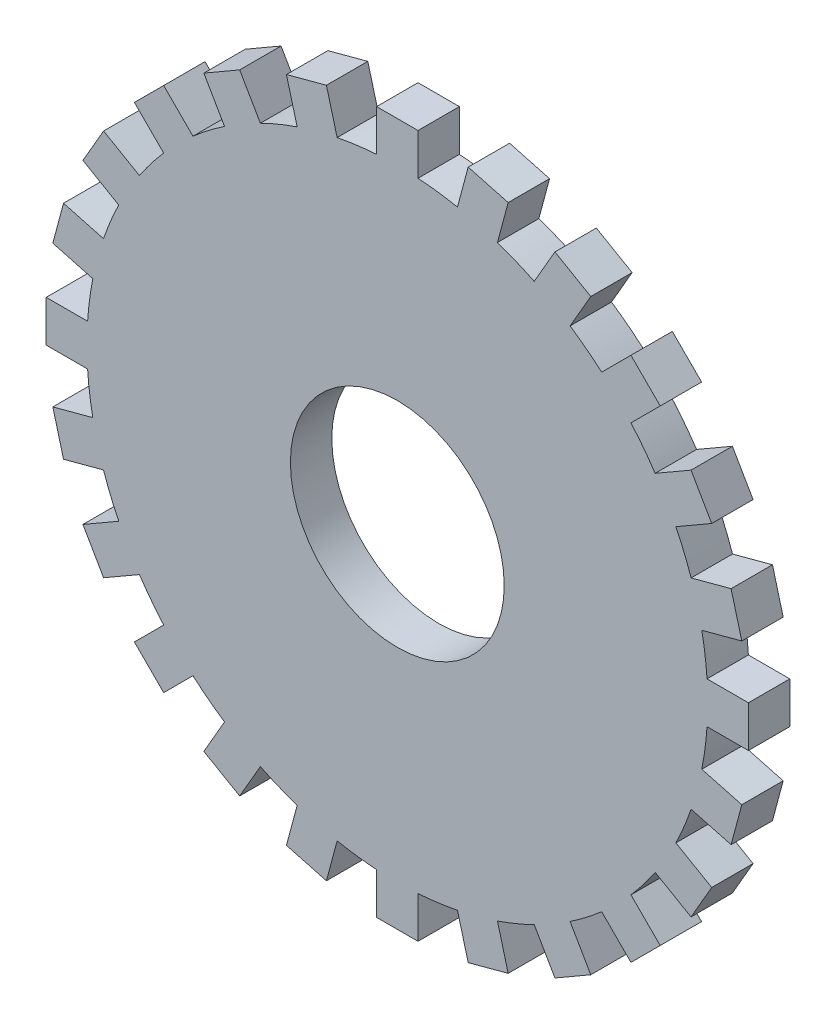
from build123d import *

# Parameters (mm, degrees)
SKETCH1_R           = 22.5
SKETCH1_R_2         = 7.75
BOSS_EXTRUDE1_DEPTH = 1.5
BOSS_EXTRUDE2_DEPTH = 1.5
CIRPATTERN1_COUNT   = 24


with BuildPart() as part:
    # Sketch1 → Boss-Extrude1 (new, symmetric)
    with BuildSketch(Plane.XY):
        Circle(SKETCH1_R)
        Circle(SKETCH1_R_2, mode=Mode.SUBTRACT)
    extrude(amount=BOSS_EXTRUDE1_DEPTH, both=True)

    # Sketch1<3> → Boss-Extrude2 (add, symmetric)
    with BuildSketch(Plane.XY):
        with BuildLine():
            Line((-1.5, 25.449944321), (-1.5, 22.449944321))
            ThreePointArc((-1.5, 22.449944321), (0, 22.5), (1.5, 22.449944321))
            Line((1.5, 22.449944321), (1.5, 25.449944321))
            Line((1.5, 25.449944321), (-1.5, 25.449944321))
        make_face()
    boss_extrude2 = extrude(amount=BOSS_EXTRUDE2_DEPTH, both=True)

    # CirPattern1: Boss-Extrude2 ×24 about axis
    cirpattern1_axis = Axis((0, 0, 13.219379373), (0, 0, -1))
    for i in range(1, CIRPATTERN1_COUNT):
        add(boss_extrude2.rotate(cirpattern1_axis, i * 360 / CIRPATTERN1_COUNT))


solid = part.part
